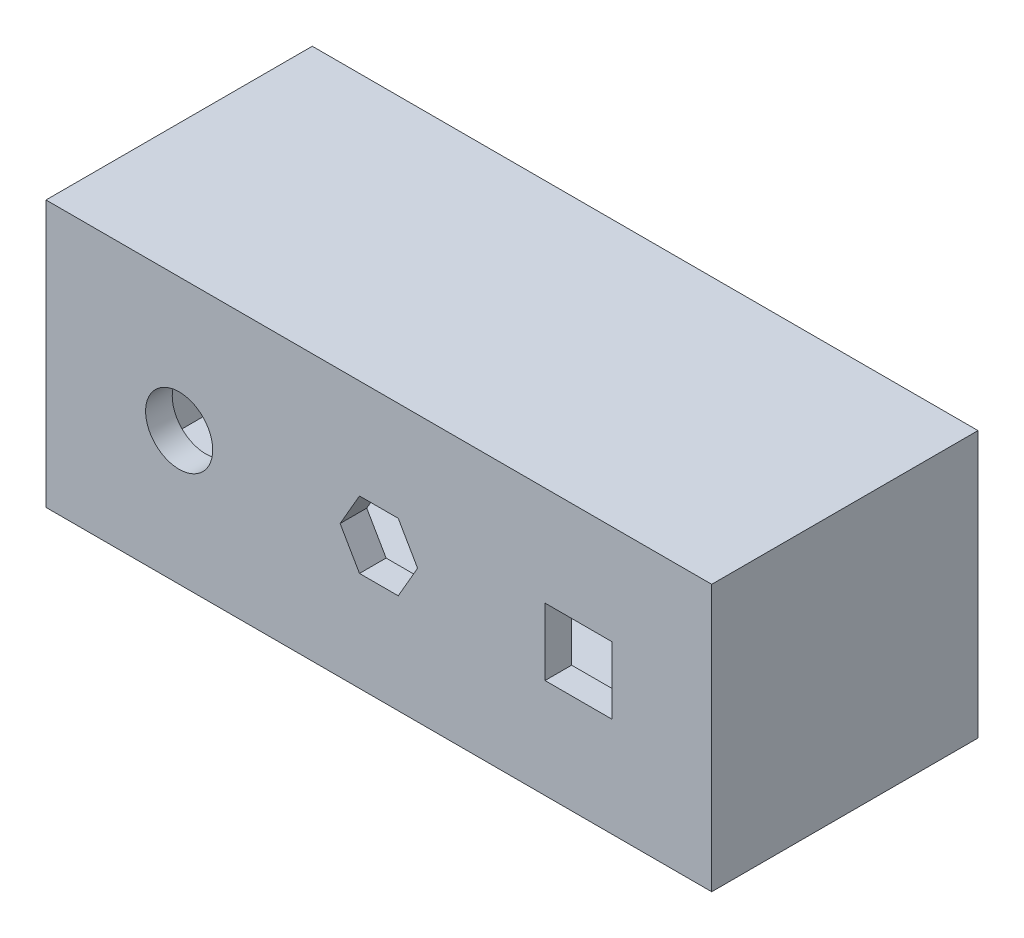
from build123d import *

# Parameters (mm, degrees)
SKETCH5_W           = 500
SKETCH5_H           = 200
BOSS_EXTRUDE2_DEPTH = 200
SHELL2_T            = -20
SKETCH6_R           = 25.2
SKETCH6_W           = 50.4
SKETCH6_H           = 50.4
CUT_EXTRUDE2_DEPTH  = 300


with BuildPart() as part:
    # Sketch5 → Boss-Extrude2 (new body)
    with BuildSketch(Plane.XY):
        Rectangle(SKETCH5_W, SKETCH5_H)
    extrude(amount=BOSS_EXTRUDE2_DEPTH)

    # Shell2
    shell2_openings = [part.faces().sort_by_distance(p)[0] for p in [
        (0, 0, 0),
    ]]
    offset(amount=SHELL2_T, openings=shell2_openings, kind=Kind.INTERSECTION)

    # Sketch6 → Cut-Extrude2 (cut)
    with BuildSketch(Plane.XY.offset(200)):
        with Locations((-150, 0)):
            Circle(SKETCH6_R)
        Polygon((14.549226784, 25.2), (-14.549226784, 25.2), (-29.098453567, 0), (-14.549226784, -25.2), (14.549226784, -25.2), (29.098453567, 0), align=None)
        with Locations((150, 0)):
            Rectangle(SKETCH6_W, SKETCH6_H)
    extrude(amount=-CUT_EXTRUDE2_DEPTH, mode=Mode.SUBTRACT)


solid = part.part
